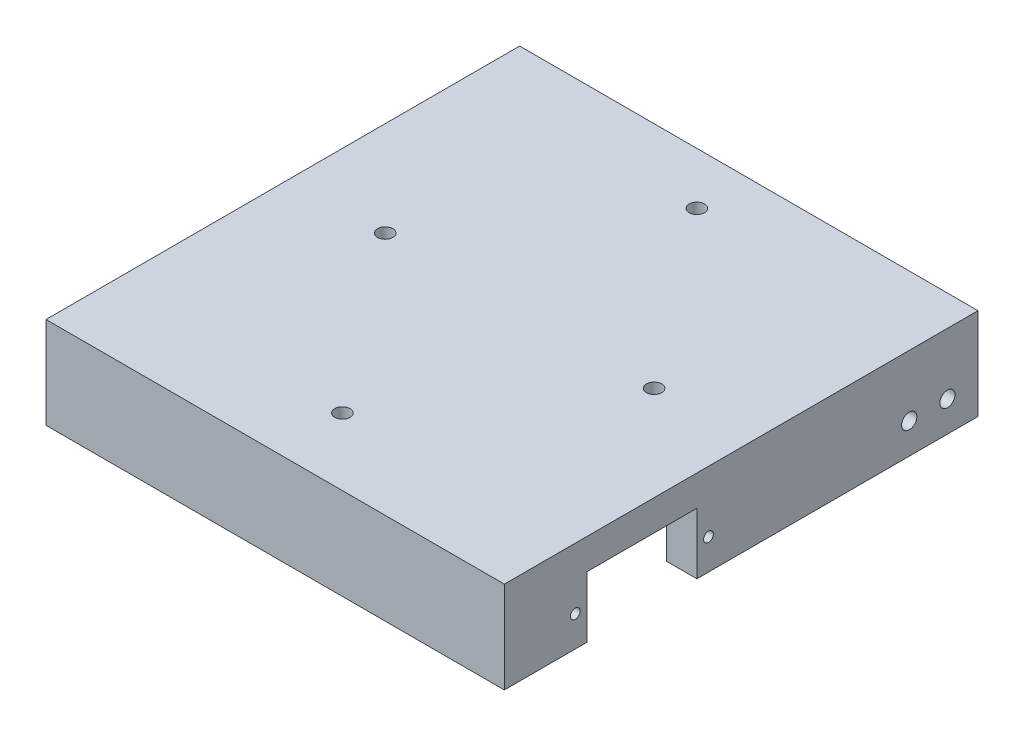
from build123d import *

# Parameters (mm, degrees)
SKETCH1_W               = 95.25
SKETCH1_H               = 95.25
BOSS_EXTRUDE1_DEPTH     = 6.35
SKETCH4_W               = 6.35
SKETCH4_H               = 95.25
BOSS_EXTRUDE2_DEPTH     = 12.7
CUT_EXTRUDE1_DEPTH      = 102.649597269
CUT_EXTRUDE1_DEPTH_BACK = 102.649597269
SKETCH5_W               = 22.86
SKETCH5_H               = 12.7
SKETCH6_R               = 1.016
CUT_EXTRUDE2_DEPTH      = 108.247345538
SKETCH7_R               = 1.5875
CUT_EXTRUDE3_DEPTH      = 69.538830235
CUT_EXTRUDE4_DEPTH      = 102.649597269
CUT_EXTRUDE4_DEPTH_BACK = 102.649597269
SKETCH8_R               = 1.5875
SKETCH9_W               = 95.25
SKETCH9_H               = 19.05
BOSS_EXTRUDE3_DEPTH     = 3.175


with BuildPart() as part:
    # Sketch1 → Boss-Extrude1 (new body)
    with BuildSketch(Plane(origin=(0, 0, 0), x_dir=(1, 0, 0), z_dir=(0, 1, 0))):
        Rectangle(SKETCH1_W, SKETCH1_H)
    extrude(amount=BOSS_EXTRUDE1_DEPTH)

    # Sketch4 → Boss-Extrude2 (add)
    with BuildSketch(Plane(origin=(0, 0, 0), x_dir=(-1, 0, 0), z_dir=(0, -1, 0))):
        with Locations((-44.45, 0)):
            Rectangle(SKETCH4_W, SKETCH4_H)
        with Locations((44.45, 0)):
            Rectangle(SKETCH4_W, SKETCH4_H)
    extrude(amount=BOSS_EXTRUDE2_DEPTH)

    # Sketch5 → Cut-Extrude1 (cut, two sides: drawn at the far end of the back side and taken through both)
    with BuildSketch(Plane(origin=(-41.275, 0, 0), x_dir=(0, 0, -1), z_dir=(1, 0, 0)).offset(-CUT_EXTRUDE1_DEPTH_BACK)):
        with Locations((-22.225, -6.35)):
            Rectangle(SKETCH5_W, SKETCH5_H)
    extrude(amount=CUT_EXTRUDE1_DEPTH + CUT_EXTRUDE1_DEPTH_BACK, mode=Mode.SUBTRACT)

    # Sketch6 → Cut-Extrude2 (cut, through all)
    with BuildSketch(Plane.ZY.offset(47.625)):
        with Locations((36.068, -6.35)):
            Circle(SKETCH6_R)
        with Locations((8.382, -6.35)):
            Circle(SKETCH6_R)
    extrude(amount=-CUT_EXTRUDE2_DEPTH, mode=Mode.SUBTRACT)

    # Sketch7 → Cut-Extrude3 (cut, through all)
    with BuildSketch(Plane.XZ):
        with Locations((27.94, 0)):
            Circle(SKETCH7_R)
        with Locations((-27.94, 0)):
            Circle(SKETCH7_R)
        with Locations((0, 36.83)):
            Circle(SKETCH7_R)
        with Locations((0, -36.83)):
            Circle(SKETCH7_R)
    extrude(amount=-CUT_EXTRUDE3_DEPTH, mode=Mode.SUBTRACT)

    # Sketch8 → Cut-Extrude4 (cut, two sides: drawn at the far end of the back side and taken through both)
    with BuildSketch(Plane(origin=(-41.275, 0, 0), x_dir=(0, 0, -1), z_dir=(1, 0, 0)).offset(-CUT_EXTRUDE4_DEPTH_BACK)):
        with Locations((41.275, -6.35)):
            Circle(SKETCH8_R)
        with Locations((33.3375, -6.35)):
            Circle(SKETCH8_R)
    extrude(amount=CUT_EXTRUDE4_DEPTH + CUT_EXTRUDE4_DEPTH_BACK, mode=Mode.SUBTRACT)

    # Sketch9 → Boss-Extrude3 (add)
    with BuildSketch(Plane.XY.offset(47.625)):
        with Locations((0, -3.175)):
            Rectangle(SKETCH9_W, SKETCH9_H)
    extrude(amount=BOSS_EXTRUDE3_DEPTH)


solid = part.part
